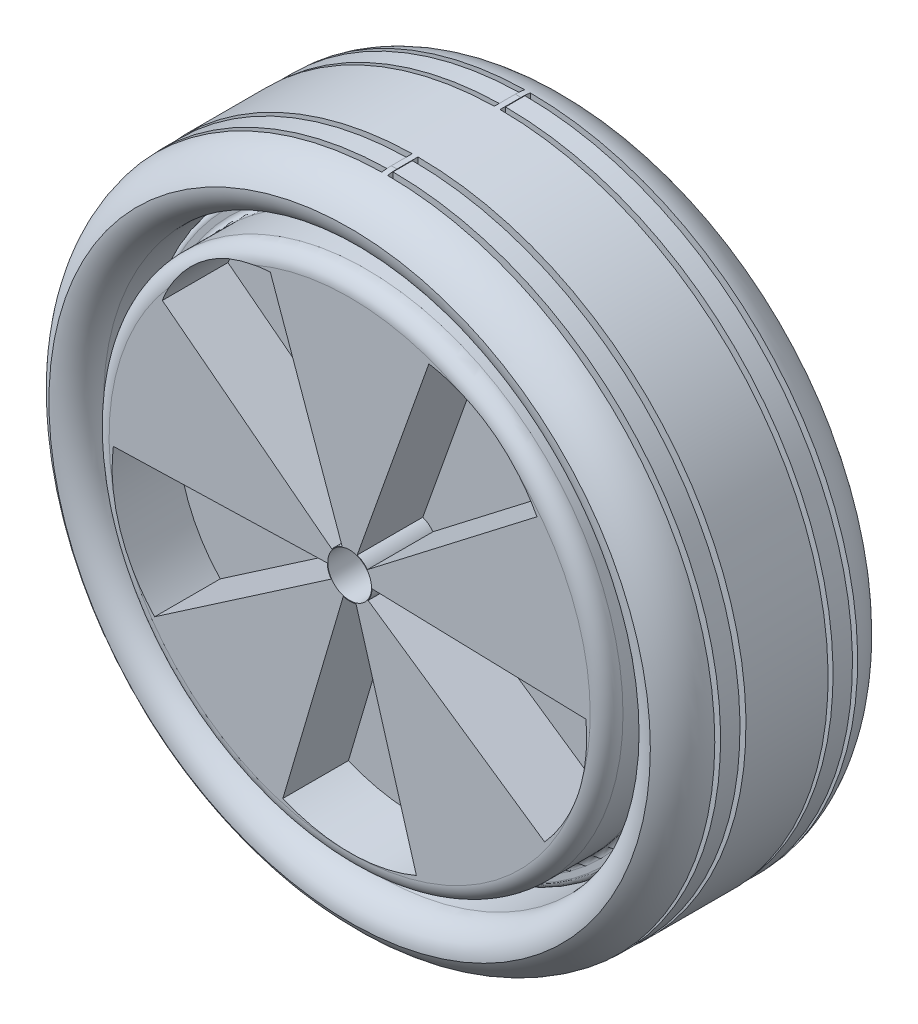
from build123d import *

# Parameters (mm, degrees)
SKETCH1_R                 = 50
BOSS_EXTRUDE1_DEPTH       = 40
CUT_EXTRUDE2_DEPTH        = 12
SKETCH3_R                 = 60
SKETCH3_R_2               = 50
BOSS_EXTRUDE2_DEPTH       = 40
CUT_EXTRUDE3_START        = -12
SKETCH4_R                 = 50
SKETCH4_R_2               = 47
CUT_EXTRUDE3_DEPTH        = 12
FILLET1_R                 = 3
FILLET2_R                 = 5
FILLET3_R                 = 1
CUT_REVOLVE_THIN2_START   = 6.935812213
CUT_REVOLVE_THIN2_DEPTH   = 1
CUT_REVOLVE_THIN2_START_2 = 11.490933941
CUT_REVOLVE_THIN2_2_DEPTH = 1
CUT_REVOLVE_THIN2_START_3 = 27.509066059
CUT_REVOLVE_THIN2_3_DEPTH = 1
CUT_REVOLVE_THIN2_START_4 = 32.064187787
CUT_REVOLVE_THIN2_4_DEPTH = 1
CUT_REVOLVE_THIN2_START_5 = 7.935812213
CUT_REVOLVE_THIN2_5_DEPTH = 3.555121728
CUT_REVOLVE_THIN2_START_6 = 28.509066059
CUT_REVOLVE_THIN2_6_DEPTH = 3.555121728
FILLET4_R                 = 10
SKETCH6_R                 = 4
CUT_EXTRUDE4_DEPTH        = 10
BOSS_EXTRUDE3_DEPTH       = 3
SKETCH8_R                 = 4.1
SKETCH8_R_2               = 4
BOSS_EXTRUDE4_DEPTH       = 12


with BuildPart() as part:
    # Sketch1 → Boss-Extrude1 (new body)
    with BuildSketch(Plane.XY):
        Circle(SKETCH1_R)
    extrude(amount=BOSS_EXTRUDE1_DEPTH)

    # Sketch2 → Cut-Extrude2 (cut)
    with BuildSketch(Plane.XY.offset(40)):
        with BuildLine():
            ThreePointArc((-3.16941305, 2.440250176), (-2.351141009, 3.236067977), (-1.341413336, 3.768369709))
            Line((-1.341413336, 3.768369709), (-14.5, 40.734171408))
            ThreePointArc((-14.5, 40.734171408), (-26.519847709, 36.501438921), (-34.259752735, 26.377870703))
            Line((-34.259752735, 26.377870703), (-3.16941305, 2.440250176))
        make_face()
        with BuildLine():
            Line((14.5, 40.734171408), (1.341413336, 3.768369709))
            ThreePointArc((1.341413336, 3.768369709), (2.351141009, 3.236067977), (3.16941305, 2.440250176))
            Line((3.16941305, 2.440250176), (34.259752735, 26.377870703))
            ThreePointArc((34.259752735, 26.377870703), (26.039540738, 35.840353089), (14.5, 40.734171408))
        make_face()
        with BuildLine():
            Line((43.221245572, -1.202768269), (3.998452085, -0.111269614))
            ThreePointArc((3.998452085, -0.111269614), (3.804226065, -1.236067977), (3.300218326, -2.260212159))
            Line((3.300218326, -2.260212159), (35.673691636, -24.431750763))
            ThreePointArc((35.673691636, -24.431750763), (41.859081171, -13.600839939), (43.221245572, -1.202768269))
        make_face()
        with BuildLine():
            ThreePointArc((1.129765954, -3.837138112), (0, -4), (-1.129765954, -3.837138112))
            Line((-1.129765954, -3.837138112), (-12.212198799, -41.477523079))
            ThreePointArc((-12.212198799, -41.477523079), (0, -43.955981315), (12.212198799, -41.477523079))
            Line((12.212198799, -41.477523079), (1.129765954, -3.837138112))
        make_face()
        with BuildLine():
            ThreePointArc((-3.300218326, -2.260212159), (-3.804226065, -1.236067977), (-3.998452085, -0.111269614))
            Line((-3.998452085, -0.111269614), (-43.221245572, -1.202768269))
            ThreePointArc((-43.221245572, -1.202768269), (-42.038182416, -13.659033461), (-35.673691636, -24.431750763))
            Line((-35.673691636, -24.431750763), (-3.300218326, -2.260212159))
        make_face()
    cut_extrude2 = extrude(amount=-CUT_EXTRUDE2_DEPTH, mode=Mode.SUBTRACT)

    # Mirror1: Cut-Extrude2 across plane
    add(cut_extrude2.mirror(Plane.XY.offset(20)), mode=Mode.SUBTRACT)

    # Sketch4 → Cut-Extrude3 (cut)
    with BuildSketch(Plane.XY.offset(40).offset(CUT_EXTRUDE3_START)):
        Circle(SKETCH4_R)
        Circle(SKETCH4_R_2, mode=Mode.SUBTRACT)
    cut_extrude3 = extrude(amount=CUT_EXTRUDE3_DEPTH, mode=Mode.SUBTRACT)

    # Mirror2: Cut-Extrude3 across plane
    add(cut_extrude3.mirror(Plane.XY.offset(20)), mode=Mode.SUBTRACT)

    # Fillet1
    # the kernel refuses this fillet: 3 mm, written as the material it takes off along each edge
    with BuildSketch(Plane(origin=(0, 0, 40), x_dir=(1, 0, 0), z_dir=(0, -1, 0))) as fillet1_piece_1:
        with BuildLine():
            CenterArc((47 - FILLET1_R, -FILLET1_R), FILLET1_R, 0, 90)
            Line((47 - FILLET1_R, 0), (47, 0))
            Line((47, 0), (47, -FILLET1_R))
        make_face()
    revolve(axis=Axis((0, 0, 40), (0, 0, 1)), mode=Mode.SUBTRACT)
    with BuildSketch(Plane(origin=(0, 0, 0), x_dir=(1, 0, 0), z_dir=(0, -1, 0))) as fillet1_piece_2:
        with BuildLine():
            CenterArc((47 - FILLET1_R, FILLET1_R), FILLET1_R, 270, 90)
            Line((47 - FILLET1_R, 0), (47, 0))
            Line((47, 0), (47, FILLET1_R))
        make_face()
    revolve(axis=Axis((0, 0, 0), (0, 0, 1)), mode=Mode.SUBTRACT)

    # Fillet3
    fillet3_edges = [part.edges().sort_by_distance(p)[0] for p in [
        (-50, 0, 28),
        (-47, 0, 28),
        (-50, 0, 12),
        (-47, 0, 12),
    ]]
    fillet(fillet3_edges, radius=FILLET3_R)

    # Sketch6 → Cut-Extrude4 (cut)
    with BuildSketch(Plane.XY.offset(40)):
        Circle(SKETCH6_R)
    extrude(amount=-CUT_EXTRUDE4_DEPTH, mode=Mode.SUBTRACT)


with BuildPart() as body_2:
    # Sketch3 → Boss-Extrude2 (new body)
    with BuildSketch(Plane.XY.offset(40)):
        Circle(SKETCH3_R)
        Circle(SKETCH3_R_2, mode=Mode.SUBTRACT)
    extrude(amount=-BOSS_EXTRUDE2_DEPTH)

    # Fillet2
    fillet2_edges = [body_2.edges().sort_by_distance(p)[0] for p in [
        (-50, 0, 0),
        (-50, 0, 40),
    ]]
    fillet(fillet2_edges, radius=FILLET2_R)

    # Cut-Revolve-Thin2: read off the stored shape, not the designer's step
    # Cut-Revolve-Thin2 outline → Cut-Revolve-Thin2 (cut)
    with BuildSketch(Plane.XY.offset(CUT_REVOLVE_THIN2_START)):
        with BuildLine():
            ThreePointArc((0, 53.718197142), (0.468773798, -53.716151717), (-0.93751181, 53.7100156))
            Line((-0.93751181, 53.7100156), (-1.047144386, 59.990861709))
            ThreePointArc((-1.047144386, 59.990861709), (0.52359213, -59.997715384), (0, 60))
            Line((0, 60), (0, 53.718197142))
        make_face()
    extrude(amount=CUT_REVOLVE_THIN2_DEPTH, mode=Mode.SUBTRACT)

    # Cut-Revolve-Thin2 2 outline → Cut-Revolve-Thin2 2 (cut)
    with BuildSketch(Plane.XY.offset(CUT_REVOLVE_THIN2_START_2)):
        with BuildLine():
            ThreePointArc((0, 53.718197142), (0.468773798, -53.716151717), (-0.93751181, 53.7100156))
            Line((-0.93751181, 53.7100156), (-1.047144386, 59.990861709))
            ThreePointArc((-1.047144386, 59.990861709), (0.52359213, -59.997715384), (0, 60))
            Line((0, 60), (0, 53.718197142))
        make_face()
    extrude(amount=CUT_REVOLVE_THIN2_2_DEPTH, mode=Mode.SUBTRACT)

    # Cut-Revolve-Thin2 3 outline → Cut-Revolve-Thin2 3 (cut)
    with BuildSketch(Plane.XY.offset(CUT_REVOLVE_THIN2_START_3)):
        with BuildLine():
            ThreePointArc((0, 53.718197142), (0.468773798, -53.716151717), (-0.93751181, 53.7100156))
            Line((-0.93751181, 53.7100156), (-1.047144386, 59.990861709))
            ThreePointArc((-1.047144386, 59.990861709), (0.52359213, -59.997715384), (0, 60))
            Line((0, 60), (0, 53.718197142))
        make_face()
    extrude(amount=CUT_REVOLVE_THIN2_3_DEPTH, mode=Mode.SUBTRACT)

    # Cut-Revolve-Thin2 4 outline → Cut-Revolve-Thin2 4 (cut)
    with BuildSketch(Plane.XY.offset(CUT_REVOLVE_THIN2_START_4)):
        with BuildLine():
            ThreePointArc((0, 53.718197142), (0.468773798, -53.716151717), (-0.93751181, 53.7100156))
            Line((-0.93751181, 53.7100156), (-1.047144386, 59.990861709))
            ThreePointArc((-1.047144386, 59.990861709), (0.52359213, -59.997715384), (0, 60))
            Line((0, 60), (0, 53.718197142))
        make_face()
    extrude(amount=CUT_REVOLVE_THIN2_4_DEPTH, mode=Mode.SUBTRACT)

    # Cut-Revolve-Thin2 5 outline → Cut-Revolve-Thin2 5 (cut)
    with BuildSketch(Plane.XY.offset(CUT_REVOLVE_THIN2_START_5)):
        with BuildLine():
            ThreePointArc((0, 53.718197142), (0.468773798, -53.716151717), (-0.93751181, 53.7100156))
            Line((-0.93751181, 53.7100156), (-0.954964216, 54.709863295))
            ThreePointArc((-0.954964216, 54.709863295), (0.477500352, -54.716113639), (0, 54.718197142))
            Line((0, 54.718197142), (0, 53.718197142))
        make_face()
        with BuildLine():
            ThreePointArc((0, 59.908674864), (0.522795137, -59.906393725), (-1.045550543, 59.899550483))
            Line((-1.045550543, 59.899550483), (-1.047144386, 59.990861709))
            ThreePointArc((-1.047144386, 59.990861709), (0.52359213, -59.997715384), (0, 60))
            Line((0, 60), (0, 59.908674864))
        make_face()
    extrude(amount=CUT_REVOLVE_THIN2_5_DEPTH, mode=Mode.SUBTRACT)

    # Cut-Revolve-Thin2 6 outline → Cut-Revolve-Thin2 6 (cut)
    with BuildSketch(Plane.XY.offset(CUT_REVOLVE_THIN2_START_6)):
        with BuildLine():
            ThreePointArc((0, 53.718197142), (0.468773798, -53.716151717), (-0.93751181, 53.7100156))
            Line((-0.93751181, 53.7100156), (-0.954964216, 54.709863295))
            ThreePointArc((-0.954964216, 54.709863295), (0.477500352, -54.716113639), (0, 54.718197142))
            Line((0, 54.718197142), (0, 53.718197142))
        make_face()
        with BuildLine():
            ThreePointArc((0, 59.908674864), (0.522795137, -59.906393725), (-1.045550543, 59.899550483))
            Line((-1.045550543, 59.899550483), (-1.047144386, 59.990861709))
            ThreePointArc((-1.047144386, 59.990861709), (0.52359213, -59.997715384), (0, 60))
            Line((0, 60), (0, 59.908674864))
        make_face()
    extrude(amount=CUT_REVOLVE_THIN2_6_DEPTH, mode=Mode.SUBTRACT)

    # Fillet4
    # the kernel refuses this fillet: 10 mm, written as the material it takes off along each edge
    with BuildSketch(Plane(origin=(0, 0, 0), x_dir=(1, 0, 0), z_dir=(0, -1, 0))) as fillet4_piece_1:
        with BuildLine():
            CenterArc((50, 8.660254038), FILLET4_R, 300, 60)
            Line((60, 8.660254038), (60, 0))
            Line((60, 0), (55, 0))
        make_face()
    revolve(axis=Axis((0, 0, 0), (0, 0, 1)), mode=Mode.SUBTRACT)
    with BuildSketch(Plane(origin=(0, 0, 40), x_dir=(1, 0, 0), z_dir=(0, -1, 0))) as fillet4_piece_2:
        with BuildLine():
            CenterArc((50, -8.660254038), FILLET4_R, 0, 60)
            Line((55, 0), (60, 0))
            Line((60, 0), (60, -8.660254038))
        make_face()
    revolve(axis=Axis((0, 0, 40), (0, 0, 1)), mode=Mode.SUBTRACT)


    add(part.part)  # Boss-Extrude3 merges part
    # Sketch7 → Boss-Extrude3 (add)
    with BuildSketch(Plane(origin=(0, 0, 0), x_dir=(-1, 0, 0), z_dir=(0, 0, -1))):
        Polygon((4.242302507, -5.56802204), (6.943199789, 0.889930721), (2.700897282, 6.457952762), (-4.242302507, 5.56802204), (-6.943199789, -0.889930721), (-2.700897282, -6.457952762), align=None)
    extrude(amount=BOSS_EXTRUDE3_DEPTH)

    # Sketch8 → Boss-Extrude4 (add)
    with BuildSketch(Plane.XY.offset(28)):
        Circle(SKETCH8_R)
        Circle(SKETCH8_R_2, mode=Mode.SUBTRACT)
    extrude(amount=BOSS_EXTRUDE4_DEPTH)


solid = body_2.part
